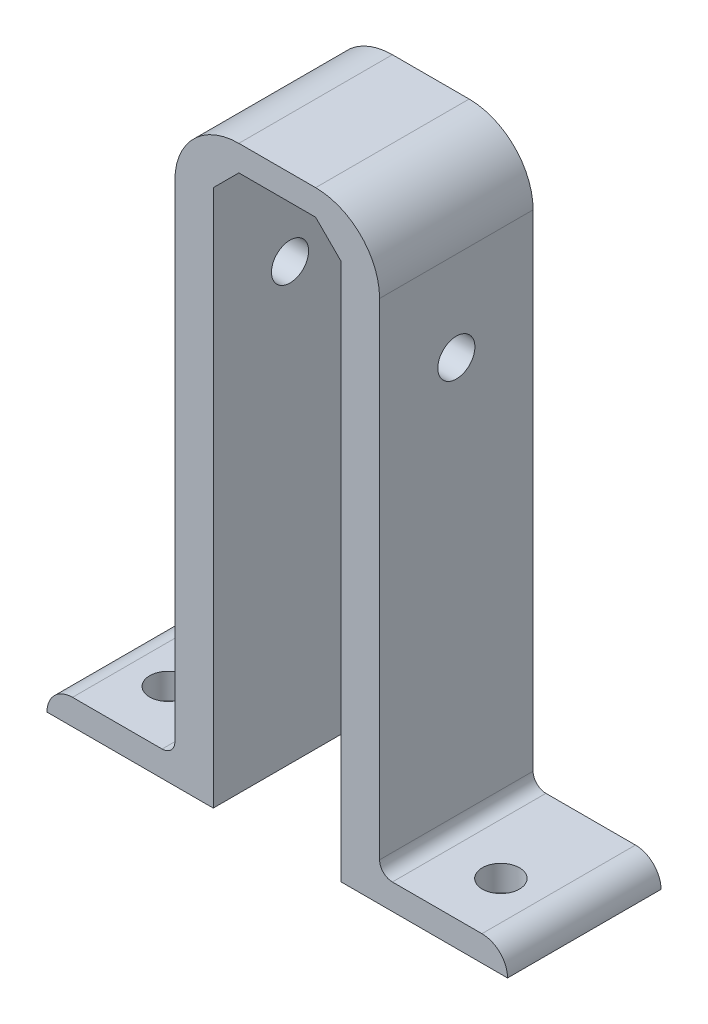
from build123d import *

# Parameters (mm, degrees)
EXTRUDE_1_DEPTH          = 12
CUT_EXTRUDE_1_DEPTH      = 15
CUT_EXTRUDE_1_DEPTH_BACK = 15
SKETCH_2_R               = 1.45
SKETCH_3_R               = 1.45
CUT_EXTRUDE_2_DEPTH      = 15
FILLET_1_R               = 1
FILLET_2_R               = 5
FILLET_3_R               = 2
CHAMFER_1_SIZE           = 2


with BuildPart() as part:
    # 草图1 → 凸台-拉伸1 (new body)
    with BuildSketch(Plane.XY):
        Polygon((0, 0), (13, 0), (13, 44), (23, 44), (23, 0), (36, 0), (36, 2), (26, 2), (26, 46), (10, 46), (10, 2), (0, 2), align=None)
    extrude(amount=EXTRUDE_1_DEPTH)

    # 草图2 → 切除-拉伸1 (cut, two sides: drawn at the far end of the back side and taken through both)
    with BuildSketch(Plane(origin=(13, 0, 0), x_dir=(0, 0, -1), z_dir=(1, 0, 0)).offset(-CUT_EXTRUDE_1_DEPTH_BACK)):
        with Locations(Location((-6, 34, 0), (0, 0, 180))):
            Circle(SKETCH_2_R)
    extrude(amount=CUT_EXTRUDE_1_DEPTH + CUT_EXTRUDE_1_DEPTH_BACK, mode=Mode.SUBTRACT)

    # 草图3 → 切除-拉伸2 (cut)
    with BuildSketch(Plane(origin=(0, 2, 0), x_dir=(1, 0, 0), z_dir=(0, 1, 0))):
        with Locations(Location((5, -7.519173445, 0), (0, 0, 180))):
            Circle(SKETCH_3_R)
        with Locations(Location((31, -7.519173445, 0), (0, 0, 180))):
            Circle(SKETCH_3_R)
    extrude(amount=-CUT_EXTRUDE_2_DEPTH, mode=Mode.SUBTRACT)

    # 圆角1
    fillet_1_edges = [part.edges().sort_by_distance(p)[0] for p in [
        (10, 2, 6),
        (26, 2, 6),
    ]]
    fillet(fillet_1_edges, radius=FILLET_1_R)

    # 圆角2
    fillet_2_edges = [part.edges().sort_by_distance(p)[0] for p in [
        (10, 46, 6),
        (26, 46, 6),
    ]]
    fillet(fillet_2_edges, radius=FILLET_2_R)

    # 圆角3
    fillet_3_edges = [part.edges().sort_by_distance(p)[0] for p in [
        (36, 2, 6),
        (0, 2, 6),
    ]]
    fillet(fillet_3_edges, radius=FILLET_3_R - 0.0001)  # a hair under: the kernel refuses the full size

    # 倒角1
    chamfer_1_edges = [part.edges().sort_by_distance(p)[0] for p in [
        (23, 44, 6),
        (13, 44, 6),
    ]]
    chamfer(chamfer_1_edges, length=CHAMFER_1_SIZE)


solid = part.part
